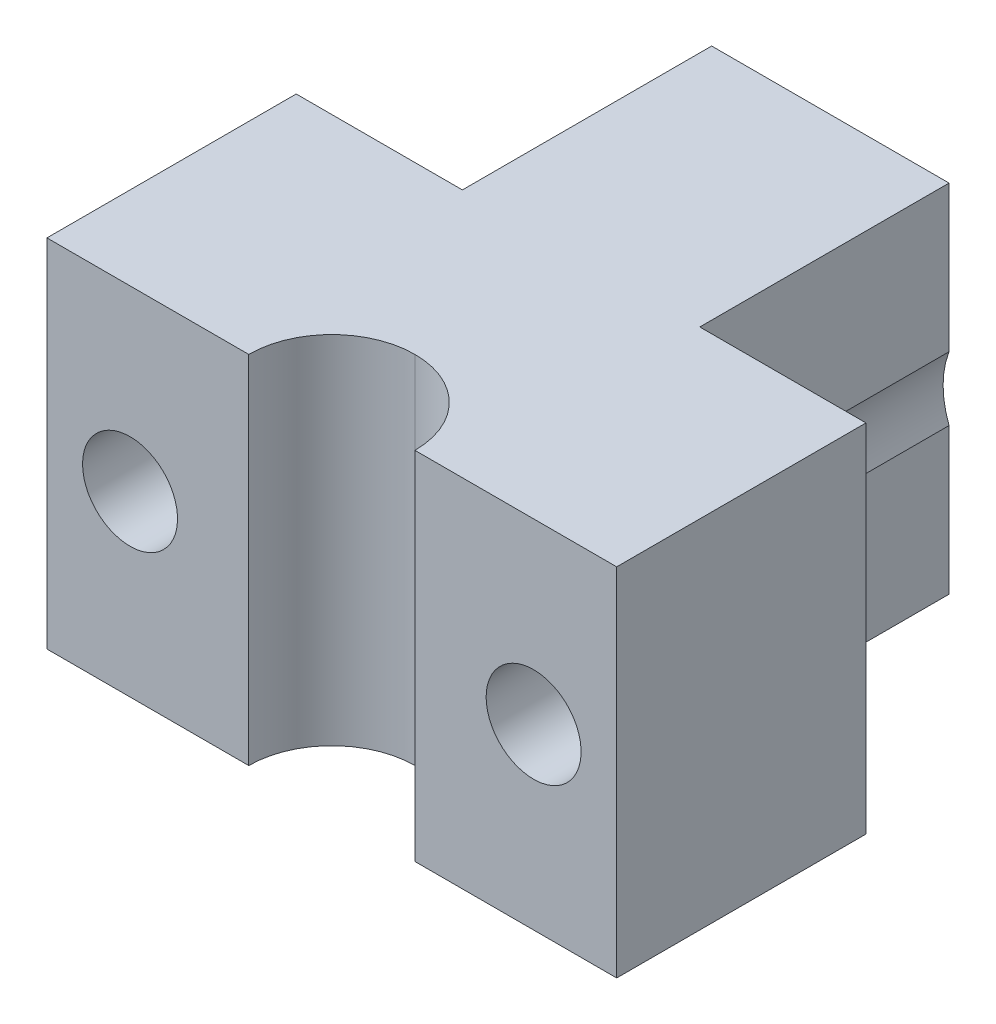
from build123d import *

# Parameters (mm, degrees)
SKETCH_1_W          = 48
SKETCH_1_H          = 20
EXTRUDE_1_DEPTH     = 30
SKETCH_2_W          = 14
SKETCH_2_H          = 30
CUT_EXTRUDE_1_DEPTH = 7
SKETCH_7_W          = 22
SKETCH_7_H          = 30
EXTRUDE_2_DEPTH     = 48
SKETCH_8_W          = 21
SKETCH_8_H          = 30
CUT_EXTRUDE_2_DEPTH = 14
SKETCH_9_W          = 21
SKETCH_9_H          = 30
CUT_EXTRUDE_3_DEPTH = 14
SKETCH_11_W         = 10.4
SKETCH_11_H         = 20.4
CUT_EXTRUDE_4_DEPTH = 56.497747702
SKETCH_13_R         = 4
CUT_EXTRUDE_5_DEPTH = 44.783558558
SKETCH_14_R         = 4
CUT_EXTRUDE_6_DEPTH = 44.783558558
FILLET_1_R          = 7
SKETCH1_W           = 10.4
SKETCH1_H           = 20.4
BOSS_EXTRUDE1_DEPTH = 4
SKETCH_20_R         = 7.5
CUT_EXTRUDE_8_DEPTH = 44.783558558


with BuildPart() as part:
    # Эскиз1 → Бобышка-Вытянуть1 (new body)
    with BuildSketch(Plane(origin=(0, 0, 0), x_dir=(1, 0, 0), z_dir=(0, 1, 0))):
        Rectangle(SKETCH_1_W, SKETCH_1_H)
    extrude(amount=EXTRUDE_1_DEPTH)

    # Эскиз2 → Вырез-Вытянуть1 (cut)
    with BuildSketch(Plane.XY.offset(10)):
        with Locations((0, 15)):
            Rectangle(SKETCH_2_W, SKETCH_2_H)
    extrude(amount=-CUT_EXTRUDE_1_DEPTH, mode=Mode.SUBTRACT)

    # Эскиз7 → Бобышка-Вытянуть2 (add)
    with BuildSketch(Plane(origin=(24, 0, 0), x_dir=(0, 0, -1), z_dir=(1, 0, 0))):
        with Locations((21, 15)):
            Rectangle(SKETCH_7_W, SKETCH_7_H)
    extrude(amount=-EXTRUDE_2_DEPTH)

    # Эскиз8 → Вырез-Вытянуть2 (cut)
    with BuildSketch(Plane(origin=(24, 0, 0), x_dir=(0, 0, -1), z_dir=(1, 0, 0))):
        with Locations((21.5, 15)):
            Rectangle(SKETCH_8_W, SKETCH_8_H)
    extrude(amount=-CUT_EXTRUDE_2_DEPTH, mode=Mode.SUBTRACT)

    # Эскиз9 → Вырез-Вытянуть3 (cut)
    with BuildSketch(Plane.ZY.offset(24)):
        with Locations((-21.5, 15)):
            Rectangle(SKETCH_9_W, SKETCH_9_H)
    extrude(amount=-CUT_EXTRUDE_3_DEPTH, mode=Mode.SUBTRACT)

    # Эскиз11 → Вырез-Вытянуть4 (cut, through all)
    with BuildSketch(Plane.ZY.offset(10)):
        with Locations((-21.5, 15)):
            Rectangle(SKETCH_11_W, SKETCH_11_H)
    extrude(amount=-CUT_EXTRUDE_4_DEPTH, mode=Mode.SUBTRACT)

    # Эскиз13 → Вырез-Вытянуть5 (cut, through all)
    with BuildSketch(Plane(origin=(0, 0, -11), x_dir=(-1, 0, 0), z_dir=(0, 0, -1))):
        with Locations((17, 15)):
            Circle(SKETCH_13_R)
    extrude(amount=-CUT_EXTRUDE_5_DEPTH, mode=Mode.SUBTRACT)

    # Эскиз14 → Вырез-Вытянуть6 (cut, through all)
    with BuildSketch(Plane(origin=(0, 0, -11), x_dir=(-1, 0, 0), z_dir=(0, 0, -1))):
        with Locations((-17, 15)):
            Circle(SKETCH_14_R)
    extrude(amount=-CUT_EXTRUDE_6_DEPTH, mode=Mode.SUBTRACT)

    # Скругление1
    fillet_1_edges = [part.edges().sort_by_distance(p)[0] for p in [
        (-7, 15, 3),
        (7, 15, 3),
    ]]
    fillet(fillet_1_edges, radius=FILLET_1_R - 0.0001)  # a hair under: the kernel refuses the full size

    # Sketch1 → Boss-Extrude1 (add)
    with BuildSketch(Plane(origin=(10, 0, 0), x_dir=(0, 0, -1), z_dir=(1, 0, 0))):
        with Locations((21.5, 15)):
            Rectangle(SKETCH1_W, SKETCH1_H)
    extrude(amount=-BOSS_EXTRUDE1_DEPTH)

    # Эскиз20 → Вырез-Вытянуть8 (cut, through all)
    with BuildSketch(Plane(origin=(0, 0, -11), x_dir=(-1, 0, 0), z_dir=(0, 0, -1))):
        with Locations((-17, 15)):
            Circle(SKETCH_20_R)
        with Locations((17, 15)):
            Circle(SKETCH_20_R)
    extrude(amount=CUT_EXTRUDE_8_DEPTH, mode=Mode.SUBTRACT)


solid = part.part
